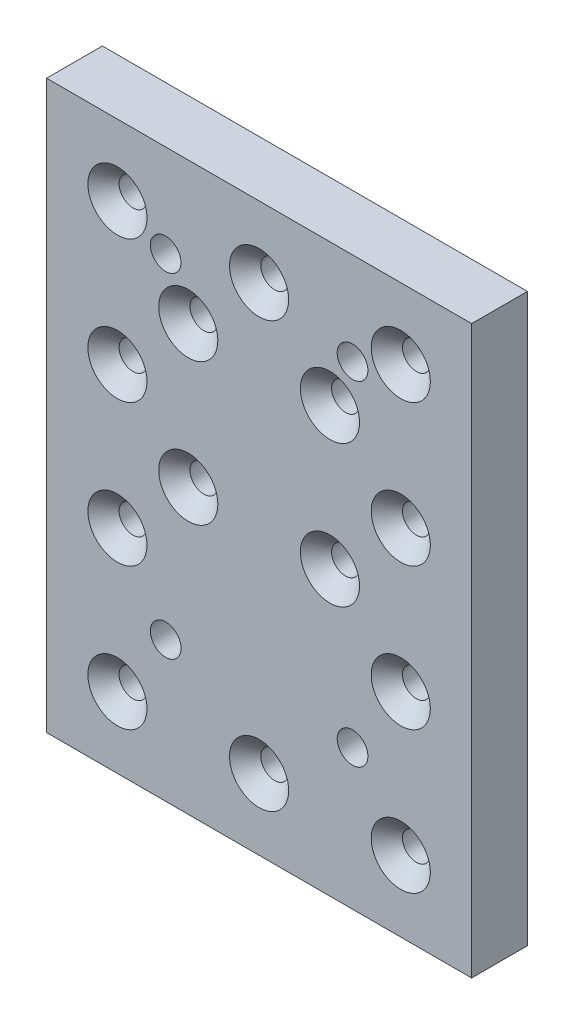
from build123d import *

# Parameters (mm, degrees)
SKETCH1_W           = 76.2
SKETCH1_H           = 101.6
SKETCH1_R           = 2.5
SKETCH1_R_2         = 2.75
BOSS_EXTRUDE1_DEPTH = 10
CHAMFER1_SIZE       = 2.8


with BuildPart() as part:
    # Sketch1 → Boss-Extrude1 (new body)
    with BuildSketch(Plane.XY):
        with Locations((-26.419970967, 29.8958)):
            Rectangle(SKETCH1_W, SKETCH1_H)
        with Locations((-1.019970967, 17.1958)):
            Circle(SKETCH1_R, mode=Mode.SUBTRACT)
        with Locations((-13.719970967, 29.8958)):
            Circle(SKETCH1_R, mode=Mode.SUBTRACT)
        with Locations((-1.019970967, 42.5958)):
            Circle(SKETCH1_R, mode=Mode.SUBTRACT)
        with Locations((-13.719970967, 55.2958)):
            Circle(SKETCH1_R, mode=Mode.SUBTRACT)
        with Locations((-1.019970967, 67.9958)):
            Circle(SKETCH1_R, mode=Mode.SUBTRACT)
        with Locations((-26.419970967, 67.9958)):
            Circle(SKETCH1_R, mode=Mode.SUBTRACT)
        with Locations((-39.119970967, 55.2958)):
            Circle(SKETCH1_R, mode=Mode.SUBTRACT)
        with Locations((-51.819970967, 67.9958)):
            Circle(SKETCH1_R, mode=Mode.SUBTRACT)
        with Locations((-51.819970967, 42.5958)):
            Circle(SKETCH1_R, mode=Mode.SUBTRACT)
        with Locations((-51.819970967, 17.1958)):
            Circle(SKETCH1_R, mode=Mode.SUBTRACT)
        with Locations((-39.119970967, 29.8958)):
            Circle(SKETCH1_R, mode=Mode.SUBTRACT)
        with Locations((-1.019970967, -8.2042)):
            Circle(SKETCH1_R, mode=Mode.SUBTRACT)
        with Locations((-26.419970967, -8.2042)):
            Circle(SKETCH1_R, mode=Mode.SUBTRACT)
        with Locations((-51.819970967, -8.2042)):
            Circle(SKETCH1_R, mode=Mode.SUBTRACT)
        with Locations((-43.169970967, 4.207209087)):
            Circle(SKETCH1_R_2, mode=Mode.SUBTRACT)
        with Locations((-9.669970967, 4.207209087)):
            Circle(SKETCH1_R_2, mode=Mode.SUBTRACT)
        with Locations((-9.669970967, 64.107209087)):
            Circle(SKETCH1_R_2, mode=Mode.SUBTRACT)
        with Locations((-43.169970967, 64.107209087)):
            Circle(SKETCH1_R_2, mode=Mode.SUBTRACT)
    extrude(amount=BOSS_EXTRUDE1_DEPTH)

    # Chamfer1
    chamfer1_edges = [part.edges().sort_by_distance(p)[0] for p in [
        (-3.519970967, 67.9958, 10),
        (-28.919970967, 67.9958, 10),
        (-54.319970967, 17.1958, 10),
        (-54.319970967, 42.5958, 10),
        (-54.319970967, 67.9958, 10),
        (-16.219970967, 55.2958, 10),
        (-41.619970967, 55.2958, 10),
        (-41.619970967, 29.8958, 10),
        (-16.219970967, 29.8958, 10),
        (-3.519970967, 42.5958, 10),
        (-3.519970967, 17.1958, 10),
        (-3.519970967, -8.2042, 10),
        (-28.919970967, -8.2042, 10),
        (-54.319970967, -8.2042, 10),
    ]]
    chamfer(chamfer1_edges, length=CHAMFER1_SIZE)


solid = part.part
